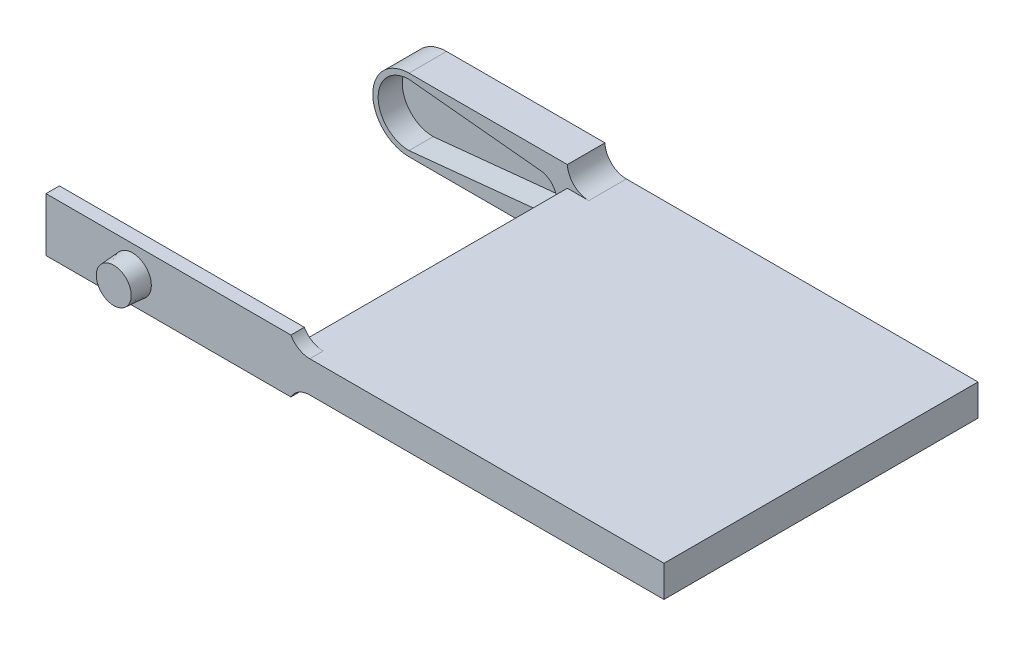
from build123d import *

# Parameters (mm, degrees)
BOSS_EXTRUDE10_DEPTH = 3.5
BOSS_EXTRUDE15_DEPTH = 1.25
SKETCH1_17_W         = 34.75
SKETCH1_17_H         = 2.924143722
BOSS_EXTRUDE17_DEPTH = 29.25
BOSS_EXTRUDE18_DEPTH = 1.25
SKETCH2_9_R          = 1.75
BOSS_EXTRUDE19_DEPTH = 1.75
BOSS_EXTRUDE19_TAPER = 4
FILLET1_R            = 2


with BuildPart() as part:
    # Sketch1 → Boss-Extrude10 (new body)
    with BuildSketch(Plane.XY):
        with BuildLine():
            ThreePointArc((0, 6.75), (-3.375, 3.375), (0, 0))
            Line((0, 0), (14.75, 0))
            Line((14.75, 0), (14.75, 6.75))
            Line((14.75, 6.75), (0, 6.75))
        make_face()
        with BuildLine():
            ThreePointArc((0, 0.5), (-2.875, 3.375), (0, 6.25))
            Line((0, 6.25), (12.265078429, 5.016721387))
            ThreePointArc((12.265078429, 5.016721387), (13.75, 3.375), (12.265078429, 1.733278613))
            Line((12.265078429, 1.733278613), (0, 0.5))
        make_face(mode=Mode.SUBTRACT)
    extrude(amount=BOSS_EXTRUDE10_DEPTH)

    # Sketch1<16> → Boss-Extrude15 (add)
    with BuildSketch(Plane.XY):
        with BuildLine():
            Line((0, 6.25), (-0.57238697, 6.192445325))
            ThreePointArc((-0.57238697, 6.192445325), (-2.875, 3.375), (-0.57238697, 0.557554675))
            Line((-0.57238697, 0.557554675), (0, 0.5))
            Line((0, 0.5), (12.265078429, 1.733278613))
            ThreePointArc((12.265078429, 1.733278613), (13.75, 3.375), (12.265078429, 5.016721387))
            Line((12.265078429, 5.016721387), (0, 6.25))
        make_face()
    extrude(amount=BOSS_EXTRUDE15_DEPTH)

    # Sketch1<17> → Boss-Extrude17 (add)
    with BuildSketch(Plane.XY):
        with Locations((32.125, 3.375)):
            Rectangle(SKETCH1_17_W, SKETCH1_17_H)
    extrude(amount=BOSS_EXTRUDE17_DEPTH)

    # Sketch2 → Boss-Extrude18 (add)
    with BuildSketch(Plane.XY.offset(29.25)):
        Polygon((13.5, 5.875), (-8.061356684, 5.875), (-8.061356684, 0.875), (14.75, 0.875), (14.75, 5.875), align=None)
    extrude(amount=-BOSS_EXTRUDE18_DEPTH)

    # Sketch2<9> → Boss-Extrude19 (add)
    with BuildSketch(Plane.XY.offset(29.25)):
        with Locations((0, 3.375)):
            Circle(SKETCH2_9_R)
    extrude(amount=BOSS_EXTRUDE19_DEPTH, taper=BOSS_EXTRUDE19_TAPER)

    # Fillet1
    # the kernel refuses this fillet: 2 mm, written as the material it adds along each edge
    with BuildSketch(Plane(origin=(14.75, 1.912928139, 0), x_dir=(0, -1, 0), z_dir=(0, 0, 1))) as fillet1_piece_1:
        with BuildLine():
            CenterArc((2, 1.998103724), FILLET1_R, 180, 87.504786267)
            Line((0, 1.998103724), (0, 0))
            Line((0, 0), (1.912928139, 0))
        make_face()
    extrude(amount=3.5)
    with BuildSketch(Plane(origin=(14.75, 4.837071861, 0), x_dir=(1, 0, 0), z_dir=(0, 0, 1))) as fillet1_piece_2:
        with BuildLine():
            CenterArc((1.998103724, 2), FILLET1_R, 182.495213733, 87.504786267)
            Line((0, 1.912928139), (0, 0))
            Line((0, 0), (1.998103724, 0))
        make_face()
    extrude(amount=3.5)
    with BuildSketch(Plane(origin=(14.75, 1.912928139, 28), x_dir=(1, 0, 0), z_dir=(0, 0, 1))) as fillet1_piece_3:
        with BuildLine():
            CenterArc((1.753401761, -2), FILLET1_R, 90, 61.246917848)
            Line((0, -1.037928139), (0, 0))
            Line((0, 0), (1.753401761, 0))
        make_face()
    extrude(amount=1.25)
    with BuildSketch(Plane(origin=(14.75, 4.837071861, 28), x_dir=(1, 0, 0), z_dir=(0, 0, 1))) as fillet1_piece_4:
        with BuildLine():
            CenterArc((1.753401761, 2), FILLET1_R, 208.753082152, 61.246917848)
            Line((0, 1.037928139), (0, 0))
            Line((0, 0), (1.753401761, 0))
        make_face()
    extrude(amount=1.25)


solid = part.part
